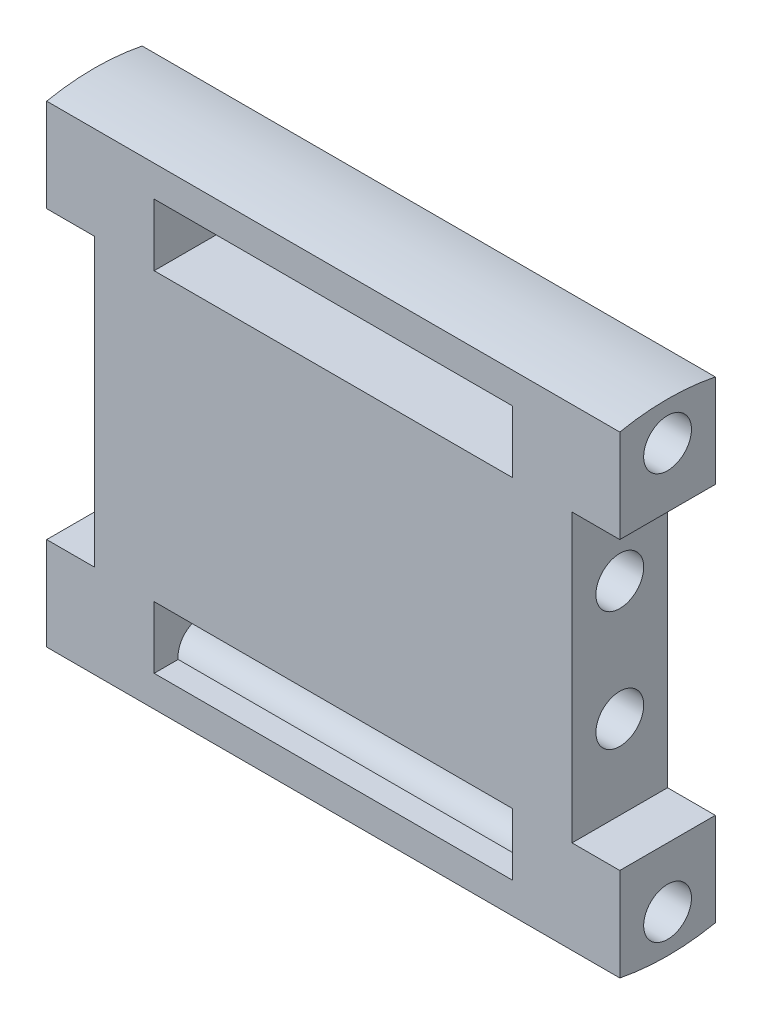
from build123d import *
from OCP.BRepFilletAPI import BRepFilletAPI_MakeChamfer

# Parameters (mm, degrees)
BOSS_EXTRUDE1_DEPTH = 125
SKETCH2_R           = 50.5
BOSS_EXTRUDE2_DEPTH = 5
SKETCH3_W           = 10
SKETCH3_H           = 60
CUT_EXTRUDE1_DEPTH  = 148.76839987
SKETCH7_W           = 62
SKETCH7_H           = 52
CUT_EXTRUDE3_DEPTH  = 5
SKETCH8_R           = 50.5
SKETCH8_W           = 62
SKETCH8_H           = 69
BOSS_EXTRUDE4_DEPTH = 140
CUT_EXTRUDE14_REACH = 159.164
SKETCH22_W          = 10
SKETCH22_H          = 25
BOSS_EXTRUDE5_DEPTH = 125
SKETCH11_W          = 140
SKETCH11_H          = 60
CUT_EXTRUDE5_DEPTH  = 397.485182573
CHAMFER2_SIZE       = 5
CHAMFER2_SIZE2      = 1.819851171
SKETCH9_R           = 5
CUT_EXTRUDE4_DEPTH  = 397.485182573
CUT_EXTRUDE6_REACH  = 399.883
SKETCH12_W          = 10
SKETCH12_H          = 60
SKETCH14_R          = 5
CUT_EXTRUDE8_DEPTH  = 397.485182573
SKETCH15_W          = 75
SKETCH15_H          = 13
CUT_EXTRUDE9_DEPTH  = 398.88252035
SKETCH17_R          = 50.5
SKETCH17_R_2        = 5
BOSS_EXTRUDE6_DEPTH = 5
CUT_EXTRUDE11_REACH = 403.404
SKETCH18_W          = 48
SKETCH18_H          = 35
SKETCH19_W          = 20
SKETCH19_H          = 20
BOSS_EXTRUDE7_DEPTH = 26
SKETCH20_W          = 23.5
SKETCH20_H          = 12.5
CUT_EXTRUDE12_DEPTH = 16
CHAMFER1_SIZE       = 4
SKETCH24_R          = 6
CUT_EXTRUDE16_DEPTH = 5
CUT_EXTRUDE13_REACH = 402.912
SKETCH21_W          = 7
SKETCH21_H          = 7
CUT_EXTRUDE15_REACH = 432.687
SKETCH23_W          = 1.5
SKETCH23_H          = 5
SKETCH16_W          = 221.910412248
SKETCH16_H          = 202.335986628
CUT_EXTRUDE10_DEPTH = 296
SKETCH25_W          = 135.205067632
SKETCH25_H          = 113.328081158
CUT_EXTRUDE17_DEPTH = 5


with BuildPart() as part:
    # Sketch1 → Boss-Extrude1 (new body)
    with BuildSketch(Plane(origin=(0, 0, 0), x_dir=(0, 0, -1), z_dir=(1, 0, 0))):
        with BuildLine():
            Line((-10, 49.5), (-10, -49.5))
            ThreePointArc((-10, -49.5), (0, -50.5), (10, -49.5))
            Line((10, -49.5), (10, 49.5))
            ThreePointArc((10, 49.5), (0, 50.5), (-10, 49.5))
        make_face()
    extrude(amount=BOSS_EXTRUDE1_DEPTH)

    # Sketch2 → Boss-Extrude2 (add)
    with BuildSketch(Plane(origin=(0, 0, 0), x_dir=(0, 0, -1), z_dir=(1, 0, 0))):
        with Locations(Location((0, 0, 0), (0, 0, 101.421186275))):
            Circle(SKETCH2_R)
    extrude(amount=BOSS_EXTRUDE2_DEPTH)

    # Sketch3 → Cut-Extrude1 (cut, through all)
    with BuildSketch(Plane(origin=(0, 0, -10), x_dir=(-1, 0, 0), z_dir=(0, 0, -1))):
        with Locations((-10, 0)):
            Rectangle(SKETCH3_W, SKETCH3_H)
        with Locations((-120, 0)):
            Rectangle(SKETCH3_W, SKETCH3_H)
    extrude(amount=-CUT_EXTRUDE1_DEPTH, mode=Mode.SUBTRACT)

    # Sketch7 → Cut-Extrude3 (cut)
    with BuildSketch(Plane.ZY):
        Rectangle(SKETCH7_W, SKETCH7_H)
    extrude(amount=-CUT_EXTRUDE3_DEPTH, mode=Mode.SUBTRACT)

    # Sketch8 → Boss-Extrude4 (add)
    with BuildSketch(Plane(origin=(125, 0, 0), x_dir=(0, 0, -1), z_dir=(1, 0, 0))):
        Circle(SKETCH8_R)
        with Locations((1.649655435, 0)):
            Rectangle(SKETCH8_W, SKETCH8_H, mode=Mode.SUBTRACT)
    extrude(amount=BOSS_EXTRUDE4_DEPTH)

    # Sketch22 → Cut-Extrude14 (cut, up to next)
    with BuildSketch(Plane.ZY.offset(-125), mode=Mode.PRIVATE) as cut_extrude14_sk1:
        with Locations((-45.5, 0)):
            Rectangle(SKETCH22_W, SKETCH22_H)
    cut_extrude14_tool1 = extrude(cut_extrude14_sk1.sketch, amount=-CUT_EXTRUDE14_REACH, mode=Mode.PRIVATE) & part.part
    add(cut_extrude14_tool1.solids().sort_by_distance((125, 0, -45.5))[0], mode=Mode.SUBTRACT)

    # Sketch10 → Boss-Extrude5 (add)
    with BuildSketch(Plane(origin=(265, 0, 0), x_dir=(0, 0, -1), z_dir=(1, 0, 0))):
        with BuildLine():
            Line((-10, 49.5), (-10, -49.5))
            ThreePointArc((-10, -49.5), (0, -50.5), (10, -49.5))
            Line((10, -49.5), (10, 49.5))
            ThreePointArc((10, 49.5), (0, 50.5), (-10, 49.5))
        make_face()
    extrude(amount=BOSS_EXTRUDE5_DEPTH)

    # Sketch11 → Cut-Extrude5 (cut, through all)
    with BuildSketch(Plane.XY):
        with Locations((195, 0)):
            Rectangle(SKETCH11_W, SKETCH11_H)
    extrude(amount=CUT_EXTRUDE5_DEPTH, mode=Mode.SUBTRACT)

    # Chamfer2: one chamfer whose edges measure the first distance from different faces: ONE call of the kernel's chamfer builder (chamfer() names one face for all edges)
    chamfer2_edges_1 = [part.edges().sort_by_distance(p)[0] for p in [
        (195, 30, 29.350344565),
    ]]
    chamfer2_side_1 = [part.faces().sort_by_distance(p)[0] for p in [
        (195, 30, 34.98680688),
    ]]
    chamfer2_edges_2 = [part.edges().sort_by_distance(p)[0] for p in [
        (195, -30, 29.350344565),
    ]]
    chamfer2_side_2 = [part.faces().sort_by_distance(p)[0] for p in [
        (195, -30, 34.98680688),
    ]]
    chamfer2 = BRepFilletAPI_MakeChamfer(part.part.solid().wrapped)
    for e in chamfer2_edges_1:
        chamfer2.Add(CHAMFER2_SIZE, CHAMFER2_SIZE2, e.wrapped, chamfer2_side_1[0].wrapped)  # the first distance lies on this face
    for e in chamfer2_edges_2:
        chamfer2.Add(CHAMFER2_SIZE, CHAMFER2_SIZE2, e.wrapped, chamfer2_side_2[0].wrapped)  # the first distance lies on this face
    add(Compound.cast(chamfer2.Shape()), mode=Mode.REPLACE)

    # Sketch9 → Cut-Extrude4 (cut, through all)
    with BuildSketch(Plane(origin=(0, 0, 0), x_dir=(0, 0, -1), z_dir=(1, 0, 0))):
        with Locations((0, -42.5)):
            Circle(SKETCH9_R)
        with Locations(Location((0, 42.5, 0), (0, 0, 180))):
            Circle(SKETCH9_R)
    extrude(amount=CUT_EXTRUDE4_DEPTH, mode=Mode.SUBTRACT)

    # Sketch12 → Cut-Extrude6 (cut, up to next)
    with BuildSketch(Plane(origin=(0, 0, -10), x_dir=(-1, 0, 0), z_dir=(0, 0, -1)), mode=Mode.PRIVATE) as cut_extrude6_sk1:
        with Locations((-270, 0)):
            Rectangle(SKETCH12_W, SKETCH12_H)
    cut_extrude6_tool1 = extrude(cut_extrude6_sk1.sketch, amount=-CUT_EXTRUDE6_REACH, mode=Mode.PRIVATE) & part.part
    # Sketch12 → Cut-Extrude6 (cut, up to next)
    with BuildSketch(Plane(origin=(0, 0, -10), x_dir=(-1, 0, 0), z_dir=(0, 0, -1)), mode=Mode.PRIVATE) as cut_extrude6_sk2:
        with Locations((-385, 0)):
            Rectangle(SKETCH12_W, SKETCH12_H)
    cut_extrude6_tool2 = extrude(cut_extrude6_sk2.sketch, amount=-CUT_EXTRUDE6_REACH, mode=Mode.PRIVATE) & part.part
    add(cut_extrude6_tool1.solids().sort_by_distance((270, 0, -10))[0], mode=Mode.SUBTRACT)
    add(cut_extrude6_tool2.solids().sort_by_distance((385, 0, -10))[0], mode=Mode.SUBTRACT)

    # Sketch14 → Cut-Extrude8 (cut, through all)
    with BuildSketch(Plane(origin=(0, 0, 0), x_dir=(0, 0, -1), z_dir=(1, 0, 0))):
        with Locations(Location((0, 12.5, 0), (0, 0, 180))):
            Circle(SKETCH14_R)
        with Locations(Location((0, -12.5, 0), (0, 0, 180))):
            Circle(SKETCH14_R)
    extrude(amount=CUT_EXTRUDE8_DEPTH, mode=Mode.SUBTRACT)

    # Sketch15 → Cut-Extrude9 (cut, through all)
    with BuildSketch(Plane.XY.offset(10)):
        with Locations((65, 36.5)):
            Rectangle(SKETCH15_W, SKETCH15_H)
        with Locations((65, -36.5)):
            Rectangle(SKETCH15_W, SKETCH15_H)
    extrude(amount=-CUT_EXTRUDE9_DEPTH, mode=Mode.SUBTRACT)

    # Sketch17 → Boss-Extrude6 (add)
    with BuildSketch(Plane(origin=(390, 0, 0), x_dir=(0, 0, -1), z_dir=(1, 0, 0))):
        Circle(SKETCH17_R)
        with Locations(Location((0, 42.5, 0), (0, 0, 180))):
            Circle(SKETCH17_R_2, mode=Mode.SUBTRACT)
        with Locations((0, -42.5)):
            Circle(SKETCH17_R_2, mode=Mode.SUBTRACT)
    extrude(amount=BOSS_EXTRUDE6_DEPTH)

    # Sketch18 → Cut-Extrude11 (cut, up to next)
    with BuildSketch(Plane(origin=(395, 0, 0), x_dir=(0, 0, -1), z_dir=(1, 0, 0)), mode=Mode.PRIVATE) as cut_extrude11_sk1:
        with Locations((-1, 0)):
            Rectangle(SKETCH18_W, SKETCH18_H)
    cut_extrude11_tool1 = extrude(cut_extrude11_sk1.sketch, amount=-CUT_EXTRUDE11_REACH, mode=Mode.PRIVATE) & part.part
    add(cut_extrude11_tool1.solids().sort_by_distance((395, 0, 1))[0], mode=Mode.SUBTRACT)

    # Sketch19 → Boss-Extrude7 (add)
    with BuildSketch(Plane(origin=(395, 0, 0), x_dir=(0, 0, -1), z_dir=(1, 0, 0))):
        with Locations((-35, 0)):
            Rectangle(SKETCH19_W, SKETCH19_H)
    extrude(amount=BOSS_EXTRUDE7_DEPTH)

    # Sketch20 → Cut-Extrude12 (cut)
    with BuildSketch(Plane(origin=(0, 0, 25), x_dir=(-1, 0, 0), z_dir=(0, 0, -1))):
        with Locations((-406.25, 0)):
            Rectangle(SKETCH20_W, SKETCH20_H)
    extrude(amount=-CUT_EXTRUDE12_DEPTH, mode=Mode.SUBTRACT)

    # Chamfer1
    # the kernel refuses this chamfer: 4 mm, written as the material it adds along each edge
    with BuildSketch(Plane(origin=(395, -10, 45), x_dir=(-0.0274958766105822, 0, 0.999621916911297), z_dir=(0, 1, 0)), Plane(origin=(395, -10, 25), x_dir=(-0.02749587661058217, -0.9996219169112968, 0), z_dir=(0, 0, 1)), Plane(origin=(395, 10, 45), x_dir=(-0.02749587661058217, 0.9996219169112968, 0), z_dir=(0, 0, -1))) as chamfer1_piece_1:
        Polygon((CHAMFER1_SIZE * 0.999621916911, CHAMFER1_SIZE * 0.0274958766106), (-CHAMFER1_SIZE * 0.0274958766106, CHAMFER1_SIZE * 0.999621916911), (0, 0), align=None)
    extrude(amount=20)
    with BuildSketch(Plane(origin=(395, -20.286731952, 45), x_dir=(-0.0274958766105822, 0, 0.999621916911297), z_dir=(0, 1, 0))) as chamfer1_piece_2a_section:
        Polygon((CHAMFER1_SIZE * 0.999621916911, CHAMFER1_SIZE * 0.0274958766106), (-CHAMFER1_SIZE * 0.0274958766106, CHAMFER1_SIZE * 0.999621916911), (0, 0), align=None)
    chamfer1_piece_2a = extrude(amount=30.286731952, mode=Mode.PRIVATE)
    chamfer1_piece_2a = chamfer1_piece_2a & Plane(origin=(396.415521785, 0, 0), x_dir=(0, 0.98019801980198, -0.19801980198019895), z_dir=(-1, 0, 0)) * Cylinder(50.5, 77, mode=Mode.PRIVATE)
    chamfer1_piece_2a = split(chamfer1_piece_2a, bisect_by=Plane(origin=(396.415521785, -10, 46.13532123), z_dir=(0, -1, 0)), keep=Keep.TOP, mode=Mode.PRIVATE)
    with BuildSketch(Plane(origin=(395, -10, 25), x_dir=(-0.02749587661058217, -0.9996219169112968, 0), z_dir=(0, 0, 1))) as chamfer1_piece_2b_section:
        Polygon((CHAMFER1_SIZE * 0.999621916911, CHAMFER1_SIZE * 0.0274958766106), (-CHAMFER1_SIZE * 0.0274958766106, CHAMFER1_SIZE * 0.999621916911), (0, 0), align=None)
    chamfer1_piece_2b = extrude(amount=30.286731952, mode=Mode.PRIVATE)
    chamfer1_piece_2b = chamfer1_piece_2b & Plane(origin=(396.349637844, 0, 0), x_dir=(0, 0.98019801980198, -0.19801980198019895), z_dir=(-1, 0, 0)) * Cylinder(50.5, 77, mode=Mode.PRIVATE)
    chamfer1_piece_2b = split(chamfer1_piece_2b, bisect_by=Plane(origin=(396.349637844, -11.262058297, 45), z_dir=(0, 0, 1)), keep=Keep.TOP, mode=Mode.PRIVATE)
    chamfer1_piece_2 = chamfer1_piece_2a & chamfer1_piece_2b
    add(chamfer1_piece_2)
    with BuildSketch(Plane(origin=(395, 10, 55.286731952), x_dir=(-0.02749587661058217, 0.9996219169112968, 0), z_dir=(0, 0, -1))) as chamfer1_piece_3a_section:
        Polygon((CHAMFER1_SIZE * 0.999621916911, CHAMFER1_SIZE * 0.0274958766106), (-CHAMFER1_SIZE * 0.0274958766106, CHAMFER1_SIZE * 0.999621916911), (0, 0), align=None)
    chamfer1_piece_3a = extrude(amount=30.286731952, mode=Mode.PRIVATE)
    chamfer1_piece_3a = chamfer1_piece_3a & Plane(origin=(396.349637844, 0, 0), x_dir=(0, 0.98019801980198, -0.19801980198019895), z_dir=(-1, 0, 0)) * Cylinder(50.5, 77, mode=Mode.PRIVATE)
    chamfer1_piece_3a = split(chamfer1_piece_3a, bisect_by=Plane(origin=(396.349637844, 11.262058297, 45), z_dir=(0, 0, 1)), keep=Keep.TOP, mode=Mode.PRIVATE)
    with BuildSketch(Plane(origin=(395, -10, 45), x_dir=(-0.0274958766105822, 0, 0.999621916911297), z_dir=(0, 1, 0))) as chamfer1_piece_3b_section:
        Polygon((CHAMFER1_SIZE * 0.999621916911, CHAMFER1_SIZE * 0.0274958766106), (-CHAMFER1_SIZE * 0.0274958766106, CHAMFER1_SIZE * 0.999621916911), (0, 0), align=None)
    chamfer1_piece_3b = extrude(amount=30.286731952, mode=Mode.PRIVATE)
    chamfer1_piece_3b = chamfer1_piece_3b & Plane(origin=(396.415521777, 0, 0), x_dir=(0, 0.98019801980198, -0.19801980198019895), z_dir=(-1, 0, 0)) * Cylinder(50.5, 77, mode=Mode.PRIVATE)
    chamfer1_piece_3b = split(chamfer1_piece_3b, bisect_by=Plane(origin=(396.415521777, 10, 46.135321233), z_dir=(0, 1, 0)), keep=Keep.TOP, mode=Mode.PRIVATE)
    chamfer1_piece_3 = chamfer1_piece_3a & chamfer1_piece_3b
    add(chamfer1_piece_3)
    # the kernel refuses this chamfer: 4 mm, written as the material it takes off along each edge
    with BuildSketch(Plane(origin=(421, -20.286731952, 45), x_dir=(0.0274958766105822, 0, -0.999621916911297), z_dir=(0, 1, 0)), Plane(origin=(421, 10, 55.286731952), x_dir=(0.027495876610582174, -0.9996219169112968, 0), z_dir=(0, 0, -1))) as chamfer1_2_piece_1:
        Polygon((CHAMFER1_SIZE * 0.999621916911, CHAMFER1_SIZE * 0.0274958766106), (-CHAMFER1_SIZE * 0.0274958766106, CHAMFER1_SIZE * 0.999621916911), (0, 0), align=None)
    extrude(amount=40.573463904, mode=Mode.SUBTRACT)
    with BuildSketch(Plane(origin=(421, -10, 14.713268048), x_dir=(-0.9996219169112968, -0.027495876610586605, 0), z_dir=(0, 0, 1))) as chamfer1_2_piece_2:
        Polygon((CHAMFER1_SIZE * 0.999621916911, -CHAMFER1_SIZE * 0.0274958766106), (-CHAMFER1_SIZE * 0.0274958766106, -CHAMFER1_SIZE * 0.999621916911), (0, 0), align=None)
    extrude(amount=40.573463904, mode=Mode.SUBTRACT)

    # Sketch24 → Cut-Extrude16 (cut)
    with BuildSketch(Plane.ZY):
        with Locations((-17, 37)):
            Circle(SKETCH24_R)
        with Locations(Location((17, 37, 0), (0, 0, 180))):
            Circle(SKETCH24_R)
        with Locations((17, -37)):
            Circle(SKETCH24_R)
        with Locations(Location((-17, -37, 0), (0, 0, 180))):
            Circle(SKETCH24_R)
    extrude(amount=-CUT_EXTRUDE16_DEPTH, mode=Mode.SUBTRACT)

    # Sketch21 → Cut-Extrude13 (cut, up to next)
    with BuildSketch(Plane(origin=(394.5, 0, 0), x_dir=(0, 0, -1), z_dir=(1, 0, 0)), mode=Mode.PRIVATE) as cut_extrude13_sk1:
        with Locations((-35.5, 0)):
            Rectangle(SKETCH21_W, SKETCH21_H)
    cut_extrude13_tool1 = extrude(cut_extrude13_sk1.sketch, amount=-CUT_EXTRUDE13_REACH, mode=Mode.PRIVATE) & part.part
    add(cut_extrude13_tool1.solids().sort_by_distance((394.5, 0, 35.5))[0], mode=Mode.SUBTRACT)

    # Sketch23 → Cut-Extrude15 (cut, up to next)
    with BuildSketch(Plane(origin=(0, 0, 25), x_dir=(-1, 0, 0), z_dir=(0, 0, -1)), mode=Mode.PRIVATE) as cut_extrude15_sk1:
        with Locations((-393.75, 0)):
            Rectangle(SKETCH23_W, SKETCH23_H)
    cut_extrude15_tool1 = extrude(cut_extrude15_sk1.sketch, amount=-CUT_EXTRUDE15_REACH, mode=Mode.PRIVATE) & part.part
    add(cut_extrude15_tool1.solids().sort_by_distance((393.75, 0, 25))[0], mode=Mode.SUBTRACT)

    # Sketch16 → Cut-Extrude10 (cut)
    with BuildSketch(Plane(origin=(421, 0, 0), x_dir=(0, 0, -1), z_dir=(1, 0, 0))):
        with Locations((18.111140578, -10.36995741)):
            Rectangle(SKETCH16_W, SKETCH16_H)
    extrude(amount=-CUT_EXTRUDE10_DEPTH, mode=Mode.SUBTRACT)

    # Sketch25 → Cut-Extrude17 (cut)
    with BuildSketch(Plane.ZY):
        Rectangle(SKETCH25_W, SKETCH25_H)
    extrude(amount=-CUT_EXTRUDE17_DEPTH, mode=Mode.SUBTRACT)


solid = part.part
